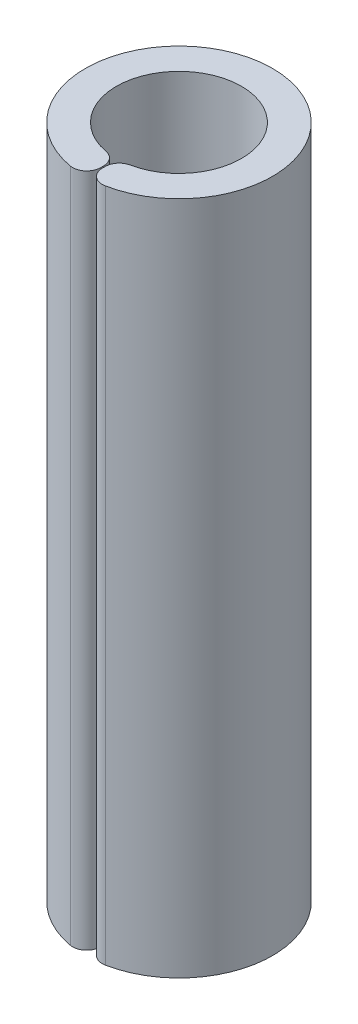
from build123d import *

# Parameters (mm, degrees)
BOSS_EXTRUDE1_DEPTH = 28.85
FILLET1_R           = 0.6


with BuildPart() as part:
    # Sketch1 → Boss-Extrude1 (new body)
    with BuildSketch(Plane(origin=(0, 0, 0), x_dir=(1, 0, 0), z_dir=(0, 1, 0))):
        with BuildLine():
            Line((0.046685187, -2.674592585), (0.069809626, -3.999390781))
            ThreePointArc((0.069809626, -3.999390781), (-0.034906142, 3.999847692), (0, -4))
            Line((0, -4), (0, -2.675))
            ThreePointArc((0, -2.675), (-0.023343482, 2.674898144), (0.046685187, -2.674592585))
        make_face()
    extrude(amount=BOSS_EXTRUDE1_DEPTH)

    # Fillet1
    fillet1_edges = [part.edges().sort_by_distance(p)[0] for p in [
        (0.069809626, 14.425, 3.999390781),
        (0, 14.425, 4),
        (0.046685187, 14.425, 2.674592585),
        (0, 14.425, 2.675),
    ]]
    fillet(fillet1_edges, radius=FILLET1_R)


solid = part.part
